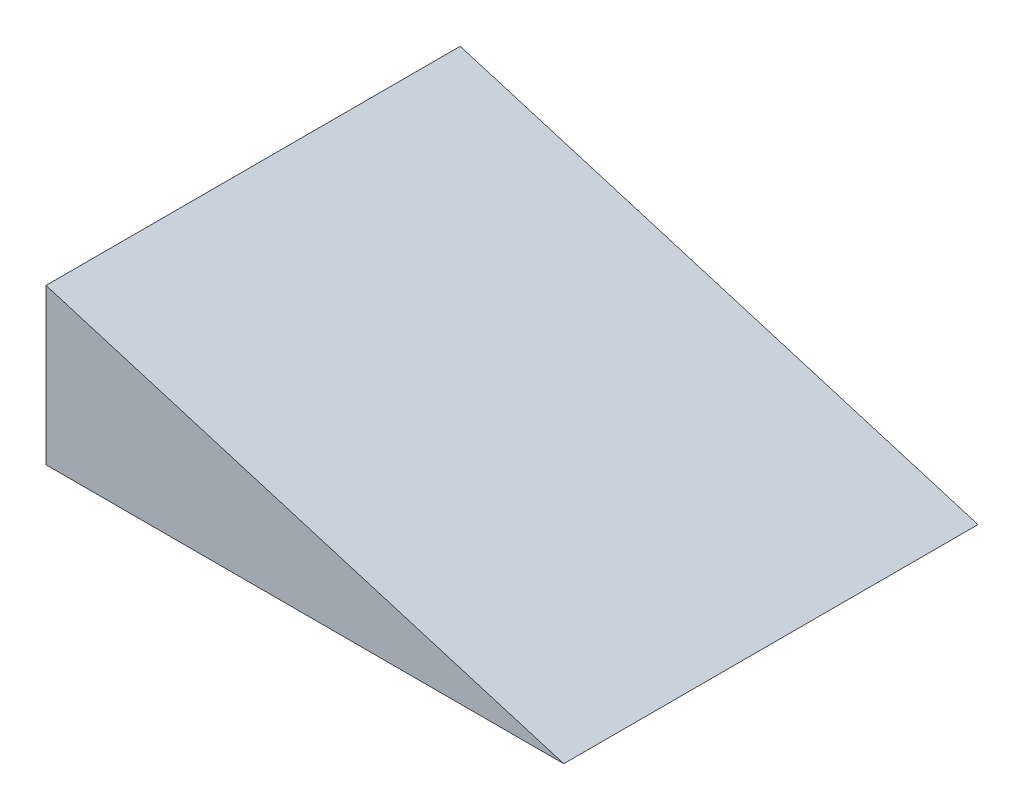
from build123d import *

# Parameters (mm, degrees)
BOSS_EXTRUDE1_DEPTH = 609.6
SHELL1_T            = -9.525


with BuildPart() as part:
    # Sketch1 → Boss-Extrude1 (new body)
    with BuildSketch(Plane.XY):
        Polygon((0, 228.6), (0, 0), (762, 0), align=None)
    extrude(amount=-BOSS_EXTRUDE1_DEPTH)

    # Shell1
    shell1_openings = [part.faces().sort_by_distance(p)[0] for p in [
        (0, 114.3, -304.8),
    ]]
    offset(amount=SHELL1_T, openings=shell1_openings, kind=Kind.INTERSECTION)


solid = part.part
